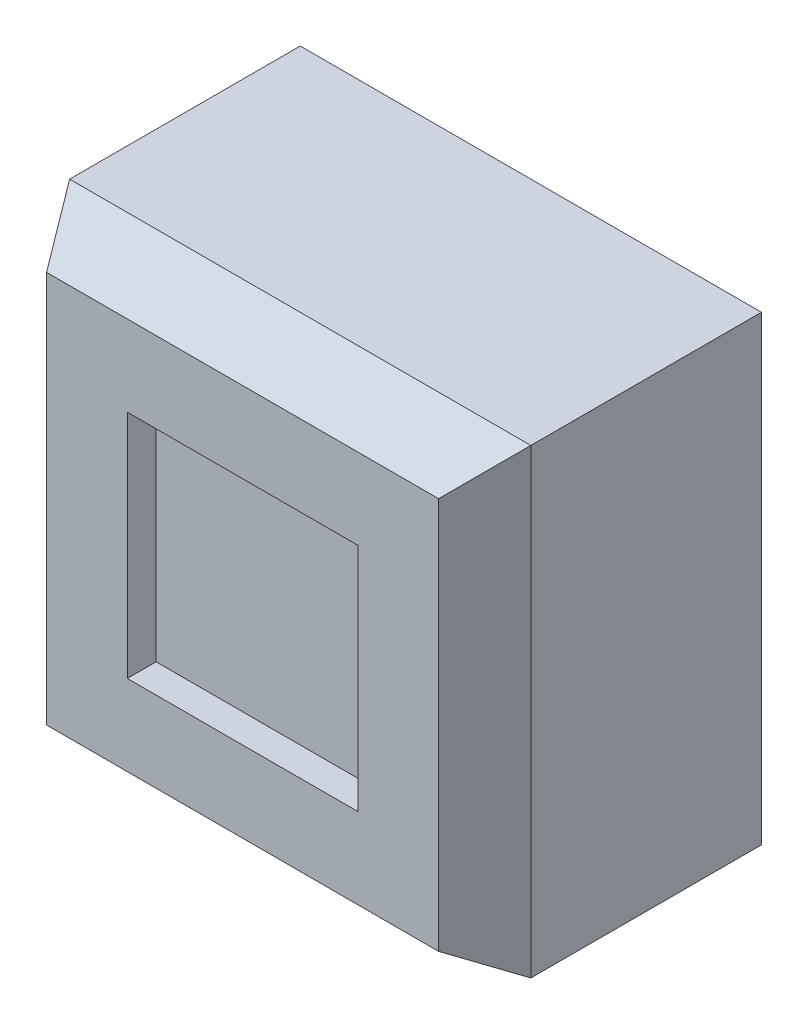
from build123d import *
from OCP.BRepFilletAPI import BRepFilletAPI_MakeChamfer

# Parameters (mm, degrees)
SKETCH1_W           = 16
SKETCH1_H           = 16
BOSS_EXTRUDE1_DEPTH = 10
SKETCH2_W           = 8
SKETCH2_H           = 8
CUT_EXTRUDE1_DEPTH  = 1
FILLET4_SIZE        = 2
FILLET4_SIZE2       = 1.2


with BuildPart() as part:
    # Sketch1 → Boss-Extrude1 (new body)
    with BuildSketch(Plane.XY):
        with Locations((8, 8)):
            Rectangle(SKETCH1_W, SKETCH1_H)
    extrude(amount=BOSS_EXTRUDE1_DEPTH)

    # Sketch2 → Cut-Extrude1 (cut)
    with BuildSketch(Plane.XY.offset(10)):
        with Locations((8, 8)):
            Rectangle(SKETCH2_W, SKETCH2_H)
    extrude(amount=-CUT_EXTRUDE1_DEPTH, mode=Mode.SUBTRACT)

    # Fillet4: one chamfer whose edges measure the first distance from different faces: ONE call of the kernel's chamfer builder (chamfer() names one face for all edges)
    fillet4_edges_1 = [part.edges().sort_by_distance(p)[0] for p in [
        (8, 0, 10),
    ]]
    fillet4_side_1 = [part.faces().sort_by_distance(p)[0] for p in [
        (8, 0, 5),
    ]]
    fillet4_edges_2 = [part.edges().sort_by_distance(p)[0] for p in [
        (16, 8, 10),
    ]]
    fillet4_side_2 = [part.faces().sort_by_distance(p)[0] for p in [
        (16, 8, 5),
    ]]
    fillet4_edges_3 = [part.edges().sort_by_distance(p)[0] for p in [
        (8, 16, 10),
    ]]
    fillet4_side_3 = [part.faces().sort_by_distance(p)[0] for p in [
        (8, 16, 5),
    ]]
    fillet4_edges_4 = [part.edges().sort_by_distance(p)[0] for p in [
        (0, 8, 10),
    ]]
    fillet4_side_4 = [part.faces().sort_by_distance(p)[0] for p in [
        (0, 8, 5),
    ]]
    fillet4 = BRepFilletAPI_MakeChamfer(part.part.solid().wrapped)
    for e in fillet4_edges_1:
        fillet4.Add(FILLET4_SIZE, FILLET4_SIZE2, e.wrapped, fillet4_side_1[0].wrapped)  # the first distance lies on this face
    for e in fillet4_edges_2:
        fillet4.Add(FILLET4_SIZE, FILLET4_SIZE2, e.wrapped, fillet4_side_2[0].wrapped)  # the first distance lies on this face
    for e in fillet4_edges_3:
        fillet4.Add(FILLET4_SIZE, FILLET4_SIZE2, e.wrapped, fillet4_side_3[0].wrapped)  # the first distance lies on this face
    for e in fillet4_edges_4:
        fillet4.Add(FILLET4_SIZE, FILLET4_SIZE2, e.wrapped, fillet4_side_4[0].wrapped)  # the first distance lies on this face
    add(Compound.cast(fillet4.Shape()), mode=Mode.REPLACE)


solid = part.part
